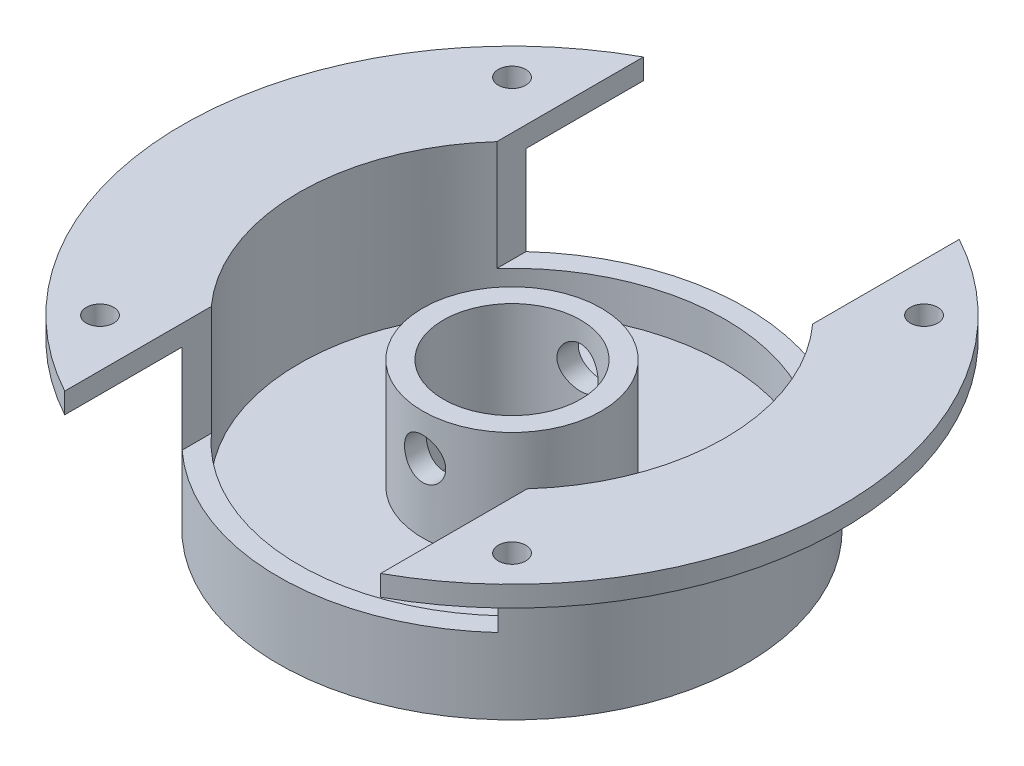
from build123d import *

# Parameters (mm, degrees)
SKETCH_2_R               = 24
SKETCH_2_R_2             = 15.5
SKETCH_2_R_3             = 1
EXTRUDE_1_DEPTH          = 1.5
EXTRUDE_START            = 12
SKETCH_4_R               = 17
SKETCH_4_R_2             = 15.5
EXTRUDE_3_DEPTH          = 12
EXTRUDE_START_2          = -1.2
SKETCH_5_R               = 17
SKETCH_5_R_2             = 5
EXTRUDE_4_DEPTH          = 1.5
SKETCH_6_W               = 23
SKETCH_6_H               = 48
CUT_EXTRUDE_1_DEPTH      = 8
SKETCH_7_R               = 6.5
SKETCH_7_R_2             = 5
EXTRUDE_5_DEPTH          = 8
CUT_EXTRUDE_2_DEPTH      = 10
CUT_EXTRUDE_2_DEPTH_BACK = 10
SKETCH_8_R               = 1.5


with BuildPart() as part:
    # 草图2 → 凸台-拉伸1 (new body)
    with BuildSketch(Plane(origin=(0, 0, 0), x_dir=(1, 0, 0), z_dir=(0, 1, 0))):
        Circle(SKETCH_2_R)
        Circle(SKETCH_2_R_2, mode=Mode.SUBTRACT)
        with Locations((-15, 15)):
            Circle(SKETCH_2_R_3, mode=Mode.SUBTRACT)
        with Locations((15, 15)):
            Circle(SKETCH_2_R_3, mode=Mode.SUBTRACT)
        with Locations((-15, -15)):
            Circle(SKETCH_2_R_3, mode=Mode.SUBTRACT)
        with Locations((15, -15)):
            Circle(SKETCH_2_R_3, mode=Mode.SUBTRACT)
    extrude(amount=EXTRUDE_1_DEPTH)

    # 草图4 → 凸台-拉伸3 (add)
    with BuildSketch(Plane.XZ.offset(EXTRUDE_START)):
        Circle(SKETCH_4_R)
        Circle(SKETCH_4_R_2, mode=Mode.SUBTRACT)
    extrude(amount=-EXTRUDE_3_DEPTH)

    # 草图5 → 凸台-拉伸4 (add)
    with BuildSketch(Plane.XZ.offset(12).offset(EXTRUDE_START_2)):
        Circle(SKETCH_5_R)
        Circle(SKETCH_5_R_2, mode=Mode.SUBTRACT)
    extrude(amount=-EXTRUDE_4_DEPTH)

    # 草图6 → 切除-拉伸1 (cut)
    with BuildSketch(Plane(origin=(0, 1.5, 0), x_dir=(1, 0, 0), z_dir=(0, 1, 0))):
        Rectangle(SKETCH_6_W, SKETCH_6_H)
    extrude(amount=-CUT_EXTRUDE_1_DEPTH, mode=Mode.SUBTRACT)

    # 草图7 → 凸台-拉伸5 (add)
    with BuildSketch(Plane(origin=(0, -9.3, 0), x_dir=(1, 0, 0), z_dir=(0, 1, 0))):
        Circle(SKETCH_7_R)
        Circle(SKETCH_7_R_2, mode=Mode.SUBTRACT)
    extrude(amount=EXTRUDE_5_DEPTH)

    # 草图8 → 切除-拉伸2 (cut, two sides: drawn at the far end of the back side and taken through both)
    with BuildSketch(Plane.XY.offset(-CUT_EXTRUDE_2_DEPTH_BACK)):
        with Locations((0, -4.3)):
            Circle(SKETCH_8_R)
    extrude(amount=CUT_EXTRUDE_2_DEPTH + CUT_EXTRUDE_2_DEPTH_BACK, mode=Mode.SUBTRACT)


solid = part.part
